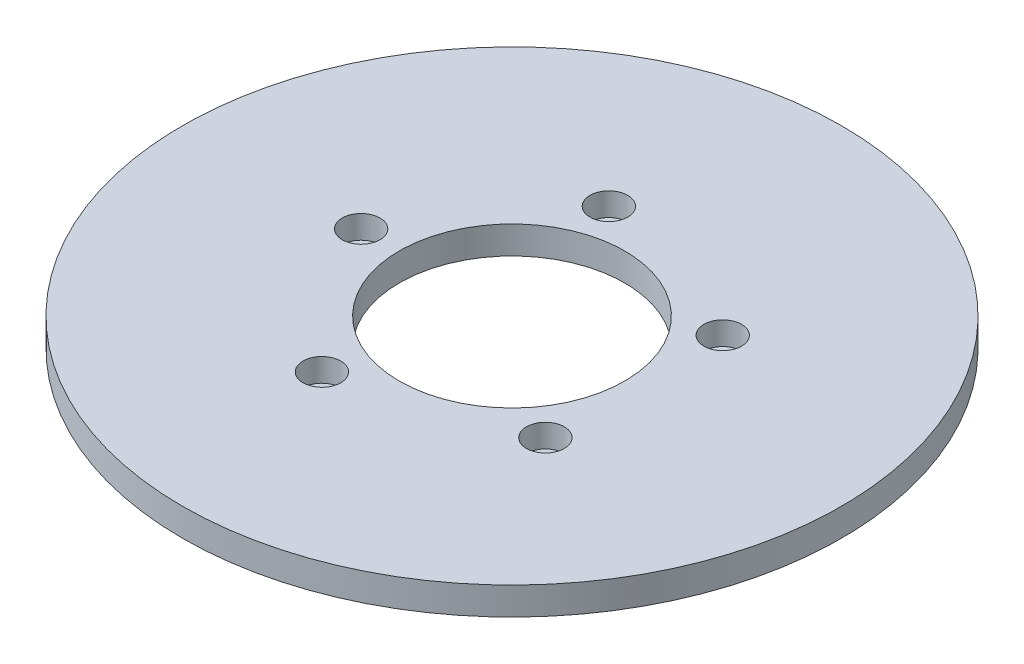
from build123d import *

# Parameters (mm, degrees)
SKETCH1_R           = 95
BOSS_EXTRUDE1_DEPTH = 8
SKETCH2_R           = 32.5
CUT_EXTRUDE1_DEPTH  = 135.588261004
SKETCH3_R           = 5.440131652
CUT_EXTRUDE2_DEPTH  = 6.675734076
CIRPATTERN1_COUNT   = 5


with BuildPart() as part:
    # Sketch1 → Boss-Extrude1 (new body)
    with BuildSketch(Plane(origin=(0, 0, 0), x_dir=(1, 0, 0), z_dir=(0, 1, 0))):
        Circle(SKETCH1_R)
    extrude(amount=BOSS_EXTRUDE1_DEPTH)

    # Sketch2 → Cut-Extrude1 (cut, through all)
    with BuildSketch(Plane(origin=(0, 0, 0), x_dir=(1, 0, 0), z_dir=(0, 1, 0))):
        Circle(SKETCH2_R)
    extrude(amount=CUT_EXTRUDE1_DEPTH, mode=Mode.SUBTRACT)

    # Sketch3 → Cut-Extrude2 (cut)
    with BuildSketch(Plane(origin=(0, 8, 0), x_dir=(1, 0, 0), z_dir=(0, 1, 0))):
        with Locations((-43.488407833, 0)):
            Circle(SKETCH3_R)
    cut_extrude2 = extrude(amount=-CUT_EXTRUDE2_DEPTH, mode=Mode.SUBTRACT)

    # CirPattern1: Cut-Extrude2 ×5 about axis
    cirpattern1_axis = Axis((0, 0, 0), (0, 1, 0))
    for i in range(1, CIRPATTERN1_COUNT):
        add(cut_extrude2.rotate(cirpattern1_axis, i * 360 / CIRPATTERN1_COUNT), mode=Mode.SUBTRACT)


solid = part.part
